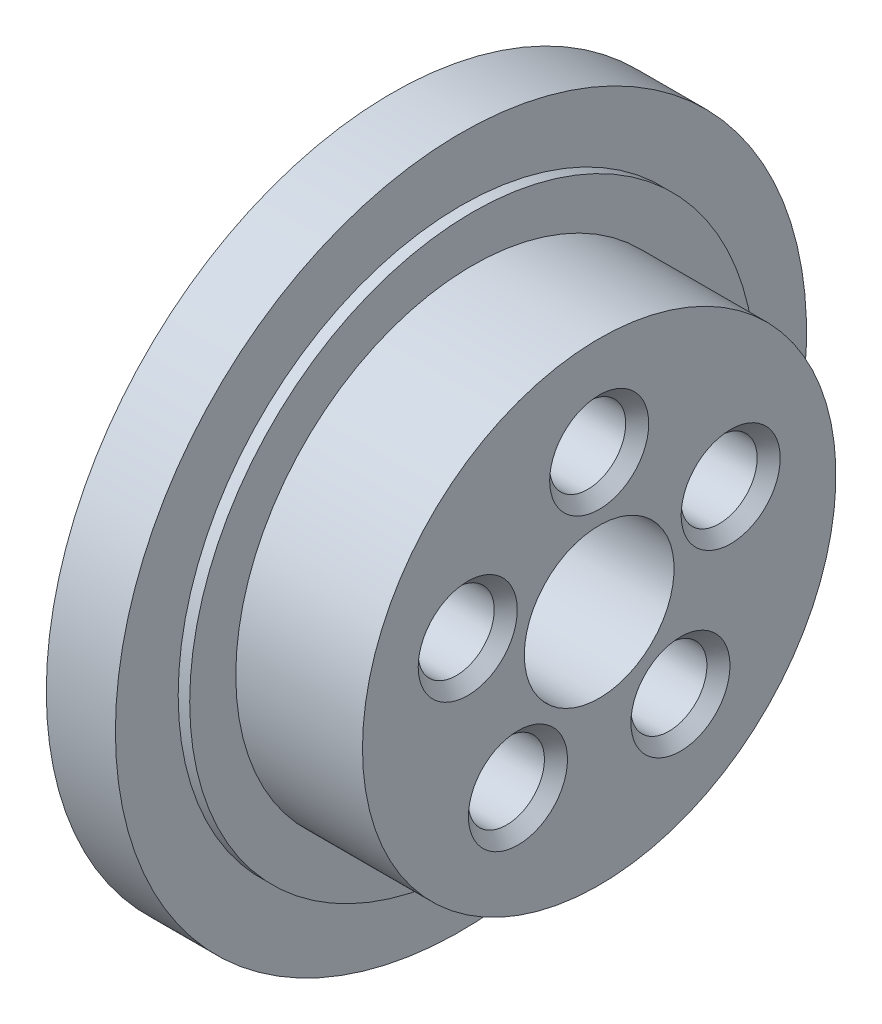
from build123d import *

# Parameters (mm, degrees)
SKETCH2_R          = 2.5
CUT_EXTRUDE1_DEPTH = 4.5
SKETCH3_R          = 3.3
CUT_EXTRUDE2_DEPTH = 10.5
CHAMFER1_SIZE      = 1


with BuildPart() as part:
    # Sketch1 → Revolve1 (revolve)
    with BuildSketch(Plane.XY):
        Polygon((0, 30), (6, 30), (6, 24.55), (7, 24.55), (7, 20.55), (18, 20.55), (18, 6.5), (6, 6.5), (6, 7.5), (0, 7.5), align=None)
    revolve(axis=Axis((0, 0, 0), (1, 0, 0)))

    # Sketch2 → Cut-Extrude1 (cut)
    with BuildSketch(Plane.ZY):
        with Locations((0, 20)):
            Circle(SKETCH2_R)
        with Locations((17.320508076, 10)):
            Circle(SKETCH2_R)
        with Locations((17.320508076, -10)):
            Circle(SKETCH2_R)
        with Locations((0, -20)):
            Circle(SKETCH2_R)
        with Locations((-17.320508076, -10)):
            Circle(SKETCH2_R)
        with Locations((-17.320508076, 10)):
            Circle(SKETCH2_R)
    extrude(amount=-CUT_EXTRUDE1_DEPTH, mode=Mode.SUBTRACT)

    # Sketch3 → Cut-Extrude2 (cut)
    with BuildSketch(Plane(origin=(18, 0, 0), x_dir=(0, 0, -1), z_dir=(1, 0, 0))):
        with Locations((0, 12)):
            Circle(SKETCH3_R)
        with Locations((11.412678196, 3.708203932)):
            Circle(SKETCH3_R)
        with Locations((7.053423028, -9.708203932)):
            Circle(SKETCH3_R)
        with Locations((-7.053423028, -9.708203932)):
            Circle(SKETCH3_R)
        with Locations((-11.412678196, 3.708203932)):
            Circle(SKETCH3_R)
    extrude(amount=-CUT_EXTRUDE2_DEPTH, mode=Mode.SUBTRACT)

    # Chamfer1
    chamfer1_edges = [part.edges().sort_by_distance(p)[0] for p in [
        (18, 3.708203932, 14.712678196),
        (18, -9.708203932, 10.353423028),
        (18, -9.708203932, -3.753423028),
        (18, 3.708203932, -8.112678196),
        (18, 12, 3.3),
    ]]
    chamfer(chamfer1_edges, length=CHAMFER1_SIZE)


solid = part.part
